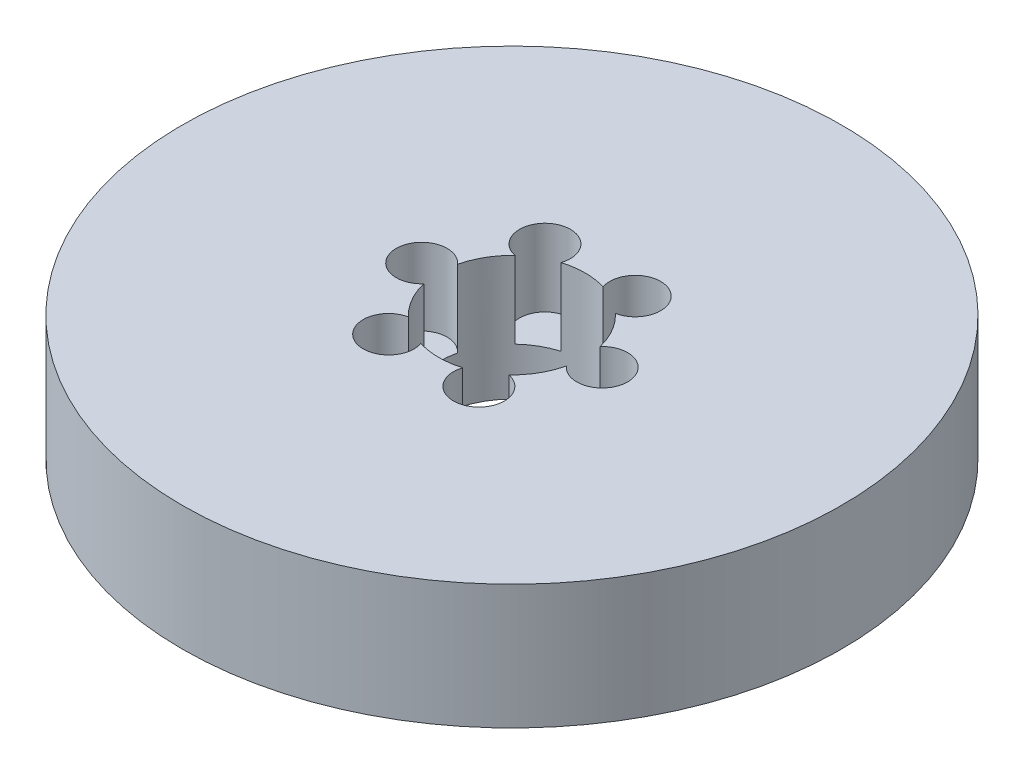
from build123d import *

# Parameters (mm, degrees)
SKETCH1_R           = 45
BOSS_EXTRUDE1_DEPTH = 17
SKETCH2_R           = 10
CUT_EXTRUDE1_DEPTH  = 66.871086221
SKETCH3_R           = 3.47392099
CUT_EXTRUDE2_DEPTH  = 10.494003051
CIRPATTERN1_COUNT   = 6


with BuildPart() as part:
    # Sketch1 → Boss-Extrude1 (new body)
    with BuildSketch(Plane(origin=(0, 0, 0), x_dir=(1, 0, 0), z_dir=(0, 1, 0))):
        Circle(SKETCH1_R)
    extrude(amount=BOSS_EXTRUDE1_DEPTH)

    # Sketch2 → Cut-Extrude1 (cut, through all)
    with BuildSketch(Plane(origin=(0, 0, 0), x_dir=(1, 0, 0), z_dir=(0, 1, 0))):
        Circle(SKETCH2_R)
    extrude(amount=CUT_EXTRUDE1_DEPTH, mode=Mode.SUBTRACT)

    # Sketch3 → Cut-Extrude2 (cut)
    with BuildSketch(Plane(origin=(0, 17, 0), x_dir=(1, 0, 0), z_dir=(0, 1, 0))):
        with Locations((-12.323672629, 0)):
            Circle(SKETCH3_R)
    cut_extrude2 = extrude(amount=-CUT_EXTRUDE2_DEPTH, mode=Mode.SUBTRACT)

    # CirPattern1: Cut-Extrude2 ×6 about axis
    cirpattern1_axis = Axis((0, 0, 0), (0, 1, 0))
    for i in range(1, CIRPATTERN1_COUNT):
        add(cut_extrude2.rotate(cirpattern1_axis, i * 360 / CIRPATTERN1_COUNT), mode=Mode.SUBTRACT)


solid = part.part
